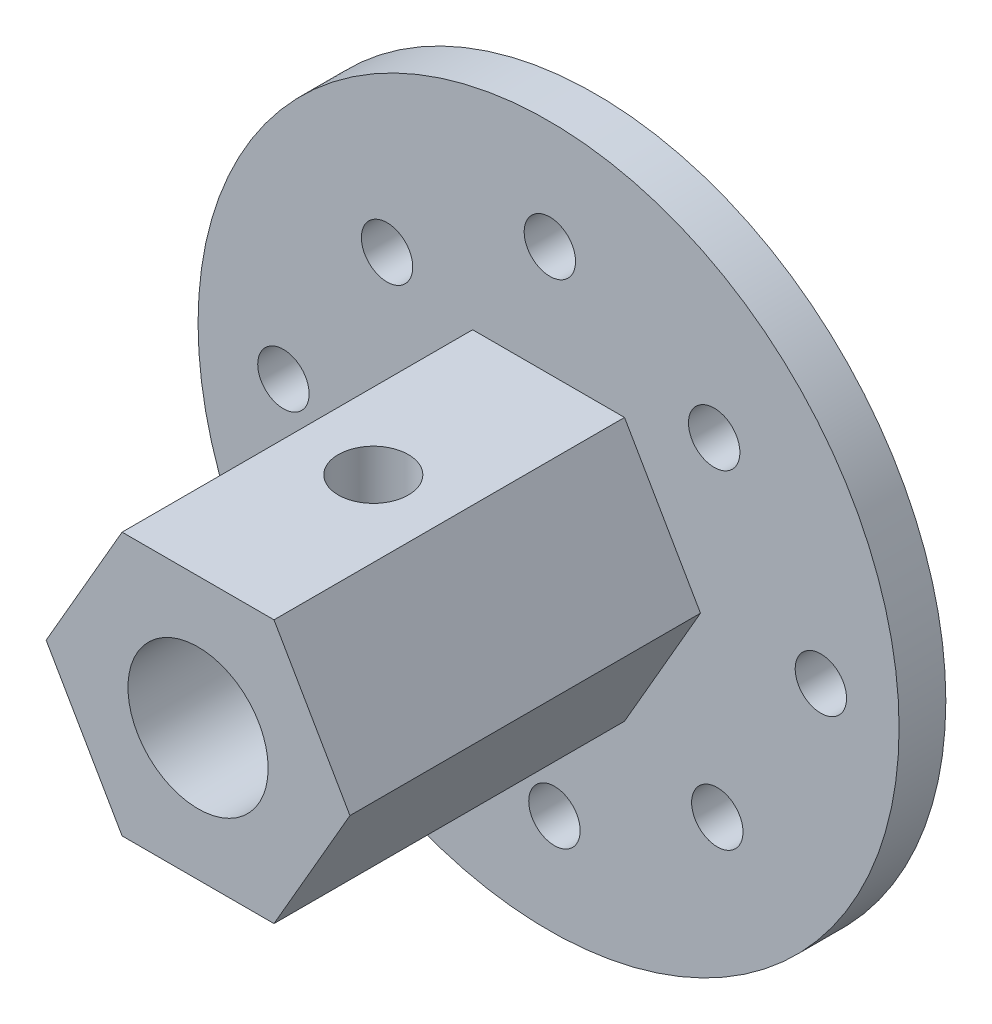
from build123d import *

# Parameters (mm, degrees)
SKETCH_1_R          = 3
EXTRUDE_1_DEPTH     = 15
SKETCH_2_R          = 15
SKETCH_2_R_2        = 3.1
SKETCH_2_R_3        = 1.1
EXTRUDE_2_DEPTH     = 2
SKETCH_3_R          = 1.5
CUT_EXTRUDE_1_DEPTH = 30.589904592


with BuildPart() as part:
    # 草图1 → 凸台-拉伸1 (new body)
    with BuildSketch(Plane.XY):
        Polygon((3.25, -5.629165125), (6.5, 0), (3.25, 5.629165125), (-3.25, 5.629165125), (-6.5, 0), (-3.25, -5.629165125), align=None)
        Circle(SKETCH_1_R, mode=Mode.SUBTRACT)
    extrude(amount=EXTRUDE_1_DEPTH)

    # 草图2 → 凸台-拉伸2 (add)
    with BuildSketch(Plane(origin=(0, 0, 0), x_dir=(-1, 0, 0), z_dir=(0, 0, -1))):
        Circle(SKETCH_2_R)
        Circle(SKETCH_2_R_2, mode=Mode.SUBTRACT)
        with Locations((-0.054658846, 10.360319416)):
            Circle(SKETCH_2_R_3, mode=Mode.SUBTRACT)
        with Locations((6.912201484, 6.667909711)):
            Circle(SKETCH_2_R_3, mode=Mode.SUBTRACT)
        with Locations((11.346782596, -0.246606579)):
            Circle(SKETCH_2_R_3, mode=Mode.SUBTRACT)
        with Locations((6.779857889, -7.331892684)):
            Circle(SKETCH_2_R_3, mode=Mode.SUBTRACT)
        with Locations((-0.25051923, -10.6387672)):
            Circle(SKETCH_2_R_3, mode=Mode.SUBTRACT)
        with Locations((-7.220104111, -7.200993699)):
            Circle(SKETCH_2_R_3, mode=Mode.SUBTRACT)
        with Locations((-11.652217031, -0.032092826)):
            Circle(SKETCH_2_R_3, mode=Mode.SUBTRACT)
        with Locations((-7.087024538, 6.795828302)):
            Circle(SKETCH_2_R_3, mode=Mode.SUBTRACT)
    extrude(amount=EXTRUDE_2_DEPTH)

    # 草图3 → 切除-拉伸1 (cut, through all)
    with BuildSketch(Plane(origin=(0, 5.629165125, 0), x_dir=(1, 0, 0), z_dir=(0, 1, 0))):
        with Locations((0, -7.5)):
            Circle(SKETCH_3_R)
    extrude(amount=-CUT_EXTRUDE_1_DEPTH, mode=Mode.SUBTRACT)


solid = part.part
